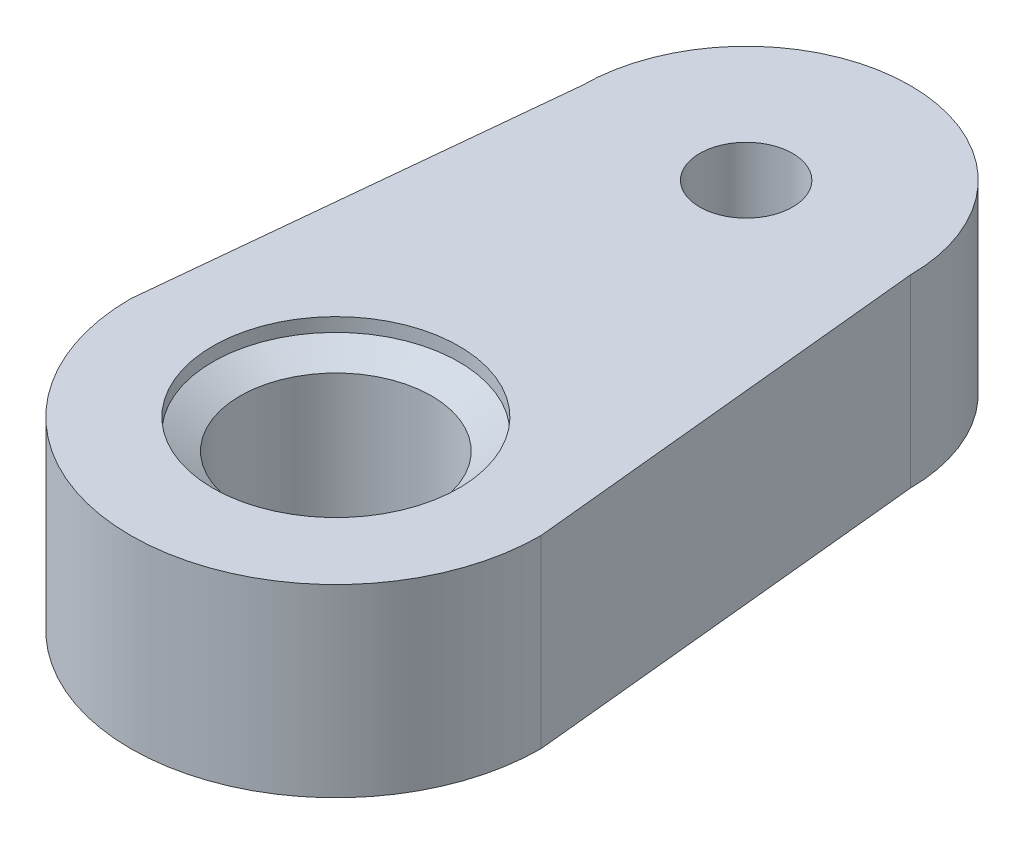
from build123d import *

# Parameters (mm, degrees)
SKETCH1_R           = 0.7
SKETCH1_R_2         = 0.34
BOSS_EXTRUDE1_DEPTH = 1.35
SKETCH2_R           = 0.9
CUT_EXTRUDE3_DEPTH  = 0.35
CHAMFER1_SIZE       = 0.25
CHAMFER1_SIZE_2     = 0.433012702


with BuildPart() as part:
    # Sketch1 → Boss-Extrude1 (new body)
    with BuildSketch(Plane(origin=(0, 0, 0), x_dir=(1, 0, 0), z_dir=(0, 1, 0))):
        with BuildLine():
            Line((-1.2, 0.221308643), (-1.5, -2.778691357))
            ThreePointArc((-1.5, -2.778691357), (0, -4.278691357), (1.5, -2.778691357))
            Line((1.5, -2.778691357), (1.2, 0.221308643))
            ThreePointArc((1.2, 0.221308643), (0, 1.421308643), (-1.2, 0.221308643))
        make_face()
        with Locations(Location((0, -2.778691357, 0), (0, 0, 90))):
            Circle(SKETCH1_R, mode=Mode.SUBTRACT)
        with Locations(Location((0, 0.221308643, 0), (0, 0, 270))):
            Circle(SKETCH1_R_2, mode=Mode.SUBTRACT)
    extrude(amount=BOSS_EXTRUDE1_DEPTH)

    # Sketch2 → Cut-Extrude3 (cut)
    with BuildSketch(Plane(origin=(0, 1.35, 0), x_dir=(1, 0, 0), z_dir=(0, 1, 0))):
        with Locations(Location((0, -2.778691357, 0), (0, 0, 270))):
            Circle(SKETCH2_R)
    extrude(amount=-CUT_EXTRUDE3_DEPTH, mode=Mode.SUBTRACT)

    # Chamfer1
    # the kernel refuses this chamfer: 0.433012702, 0.25 mm, written as the material it adds along each edge
    with BuildSketch(Plane(origin=(0, 1, 2.778691357), x_dir=(0, 0, 1), z_dir=(-1, 0, 0))) as chamfer1_piece_1_section:
        Polygon((0.9, CHAMFER1_SIZE), (0.9 - CHAMFER1_SIZE_2, 0), (0.9, 0), align=None)
    chamfer1_piece_1 = revolve(axis=Axis((0, 1, 2.778691357), (0, 1, 0)), mode=Mode.PRIVATE)
    chamfer1_piece_1 = chamfer1_piece_1 - Plane(origin=(0, 1.191367734, 2.778691357), x_dir=(0, 0, -1), z_dir=(0, -1, 0)) * Cylinder(0.7, 4, mode=Mode.PRIVATE)
    add(chamfer1_piece_1)


solid = part.part
